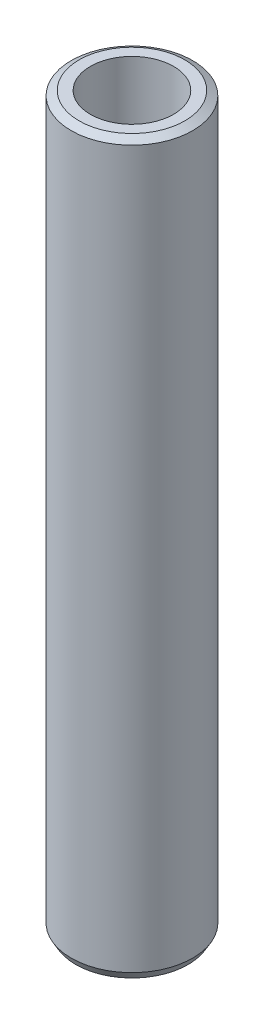
from build123d import *
from OCP.BRepFilletAPI import BRepFilletAPI_MakeChamfer

# Parameters (mm, degrees)
SKETCH1_R           = 50
BOSS_EXTRUDE1_DEPTH = 600
SKETCH2_R           = 34.247047309
CUT_EXTRUDE1_DEPTH  = 605.15229868
CHAMFER1_SIZE       = 3.739518455
CHAMFER1_SIZE2      = 6.47703596


with BuildPart() as part:
    # Sketch1 → Boss-Extrude1 (new body)
    with BuildSketch(Plane(origin=(0, 0, 0), x_dir=(1, 0, 0), z_dir=(0, 1, 0))):
        Circle(SKETCH1_R)
    extrude(amount=BOSS_EXTRUDE1_DEPTH)

    # Sketch2 → Cut-Extrude1 (cut, through all)
    with BuildSketch(Plane(origin=(0, 0, 0), x_dir=(1, 0, 0), z_dir=(0, 1, 0))):
        Circle(SKETCH2_R)
    extrude(amount=CUT_EXTRUDE1_DEPTH, mode=Mode.SUBTRACT)

    # Chamfer1: one chamfer whose edges measure the first distance from different faces: ONE call of the kernel's chamfer builder (chamfer() names one face for all edges)
    chamfer1_edges_1 = [part.edges().sort_by_distance(p)[0] for p in [
        (-50, 600, 0),
    ]]
    chamfer1_side_1 = [part.faces().sort_by_distance(p)[0] for p in [
        (-50, 300, 0),
    ]]
    chamfer1_edges_2 = [part.edges().sort_by_distance(p)[0] for p in [
        (-50, 0, 0),
    ]]
    chamfer1_side_2 = [part.faces().sort_by_distance(p)[0] for p in [
        (-48.585786438, 0, 0),
    ]]
    chamfer1 = BRepFilletAPI_MakeChamfer(part.part.solid().wrapped)
    for e in chamfer1_edges_1:
        chamfer1.Add(CHAMFER1_SIZE, CHAMFER1_SIZE2, e.wrapped, chamfer1_side_1[0].wrapped)  # the first distance lies on this face
    for e in chamfer1_edges_2:
        chamfer1.Add(CHAMFER1_SIZE, CHAMFER1_SIZE2, e.wrapped, chamfer1_side_2[0].wrapped)  # the first distance lies on this face
    add(Compound.cast(chamfer1.Shape()), mode=Mode.REPLACE)


solid = part.part
